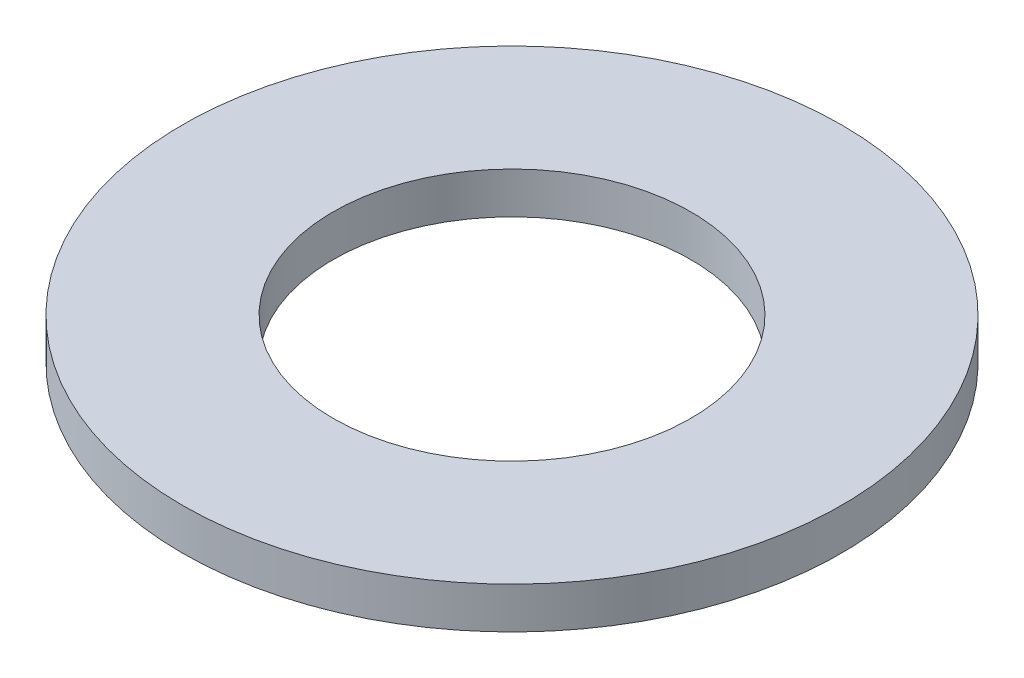
from build123d import *

# Parameters (mm, degrees)
SKETCH1_R           = 87.5
BOSS_EXTRUDE1_DEPTH = 11
SKETCH2_R           = 47.5
CUT_EXTRUDE1_DEPTH  = 125.231638482


with BuildPart() as part:
    # Sketch1 → Boss-Extrude1 (new body)
    with BuildSketch(Plane(origin=(0, 0, 0), x_dir=(1, 0, 0), z_dir=(0, 1, 0))):
        Circle(SKETCH1_R)
    extrude(amount=BOSS_EXTRUDE1_DEPTH)

    # Sketch2 → Cut-Extrude1 (cut, through all)
    with BuildSketch(Plane(origin=(0, 0, 0), x_dir=(1, 0, 0), z_dir=(0, 1, 0))):
        Circle(SKETCH2_R)
    extrude(amount=CUT_EXTRUDE1_DEPTH, mode=Mode.SUBTRACT)


solid = part.part
